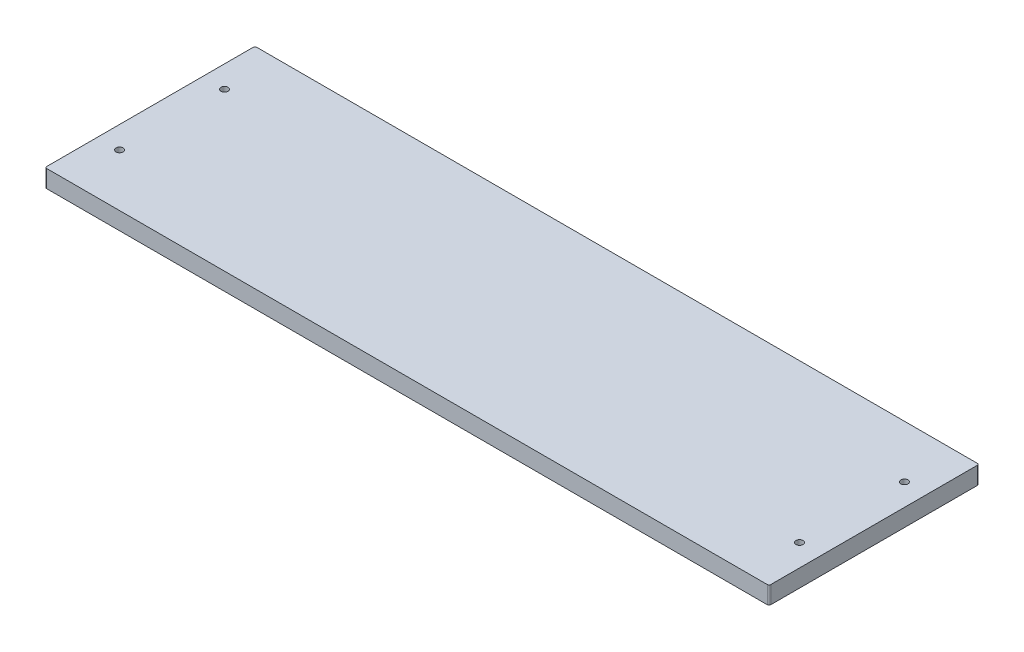
from build123d import *

# Parameters (mm, degrees)
SKETCH1_W              = 525.4625
SKETCH1_H              = 152.4
BOSS_EXTRUDE1_DEPTH    = 12.7
F_10_CLEARANCE_HOLE1_D = 5.1054
FILLET1_R              = 1.27


with BuildPart() as part:
    # Sketch1 → Boss-Extrude1 (new body)
    with BuildSketch(Plane(origin=(0, 0, 0), x_dir=(1, 0, 0), z_dir=(0, 1, 0))):
        Rectangle(SKETCH1_W, SKETCH1_H)
    extrude(amount=BOSS_EXTRUDE1_DEPTH)

    # #10 Clearance Hole1 (through all)
    with Locations(Plane(origin=(0, 12.7, 0), x_dir=(1, 0, 0), z_dir=(0, 1, 0))):
        with Locations((246.72925, -38.1), (-246.72925, 38.1), (-246.72925, -38.1), (246.72925, 38.1)):
            Hole(F_10_CLEARANCE_HOLE1_D / 2)

    # Fillet1
    fillet1_edges = [part.edges().sort_by_distance(p)[0] for p in [
        (262.73125, 6.35, 76.2),
        (262.73125, 6.35, -76.2),
        (-262.73125, 6.35, 76.2),
        (-262.73125, 6.35, -76.2),
    ]]
    fillet(fillet1_edges, radius=FILLET1_R)


solid = part.part
